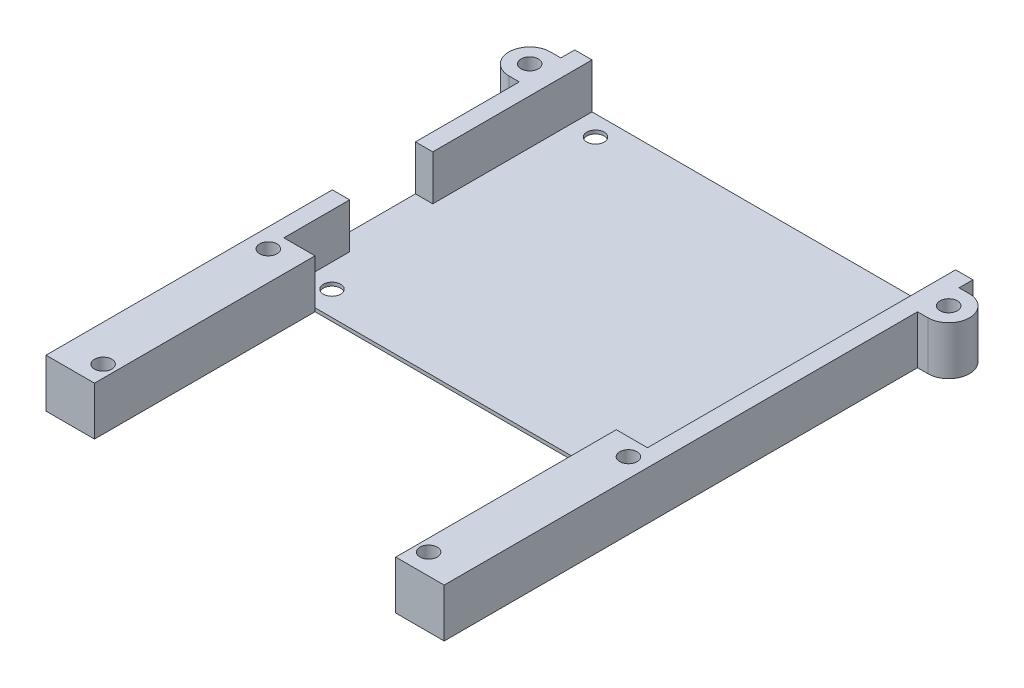
from build123d import *

# Parameters (mm, degrees)
BOSS_EXTRUDE1_DEPTH            = 0.5
BOSS_EXTRUDE2_DEPTH            = 7
F_2_5_2_5_DIAMETER_HOLE1_D     = 2.5
F_2_5_2_5_DIAMETER_HOLE1_DEPTH = 12
F_2_5_2_5_DIAMETER_HOLE1_TIP   = 0.751075774


with BuildPart() as part:
    # Sketch1 → Boss-Extrude1 (new body)
    with BuildSketch(Plane(origin=(0, 0, 0), x_dir=(1, 0, 0), z_dir=(0, 1, 0))):
        Polygon((26.25, 31.85), (26.25, 76.35), (-26.25, 76.35), (-26.25, 53.35), (-28.75, 53.35), (-28.75, 41.35), (-26.25, 41.35), (-26.25, 31.85), align=None)
    extrude(amount=BOSS_EXTRUDE1_DEPTH)

    # Sketch1<3> → Boss-Extrude2 (add)
    with BuildSketch(Plane(origin=(0, 0, 0), x_dir=(1, 0, 0), z_dir=(0, 1, 0))):
        with BuildLine():
            Line((-26.25, 76.35), (-28.75, 76.35))
            Line((-28.75, 76.35), (-28.75, 74.35))
            Line((-28.75, 74.35), (-30.25, 74.35))
            ThreePointArc((-30.25, 74.35), (-33.25, 71.35), (-30.25, 68.35))
            Line((-30.25, 68.35), (-28.75, 68.35))
            Line((-28.75, 68.35), (-28.75, 53.35))
            Line((-28.75, 53.35), (-26.25, 53.35))
            Line((-26.25, 53.35), (-26.25, 76.35))
        make_face()
        with BuildLine():
            Line((28.75, 76.35), (26.25, 76.35))
            Line((26.25, 76.35), (26.25, 31.85))
            Line((26.25, 31.85), (21.75, 31.85))
            Line((21.75, 31.85), (21.75, 0))
            Line((21.75, 0), (28.75, 0))
            Line((28.75, 0), (28.75, 68.35))
            Line((28.75, 68.35), (30.25, 68.35))
            ThreePointArc((30.25, 68.35), (33.25, 71.35), (30.25, 74.35))
            Line((30.25, 74.35), (28.75, 74.35))
            Line((28.75, 74.35), (28.75, 76.35))
        make_face()
        Polygon((-26.25, 31.85), (-26.25, 41.35), (-28.75, 41.35), (-28.75, 0), (-21.75, 0), (-21.75, 31.85), align=None)
    extrude(amount=BOSS_EXTRUDE2_DEPTH)

    # Ø2.5 (2.5) Diameter Hole1
    with Locations(Plane(origin=(0, 0, 0), x_dir=(-1, 0, 0), z_dir=(0, -1, 0))):
        with Locations((-22.85, 73.45), (22.85, 73.45), (26, 29.35), (22.85, 35.4), (-22.85, 35.4), (-26, 29.35), (-23.5, 3), (23.5, 3), (-30.25, 71.35), (30.25, 71.35)):
            Hole(F_2_5_2_5_DIAMETER_HOLE1_D / 2, depth=F_2_5_2_5_DIAMETER_HOLE1_DEPTH)
            with Locations((0, 0, -(F_2_5_2_5_DIAMETER_HOLE1_DEPTH + F_2_5_2_5_DIAMETER_HOLE1_TIP / 2))):  # 118° drill point
                Cone(0, F_2_5_2_5_DIAMETER_HOLE1_D / 2, F_2_5_2_5_DIAMETER_HOLE1_TIP, mode=Mode.SUBTRACT)


solid = part.part
